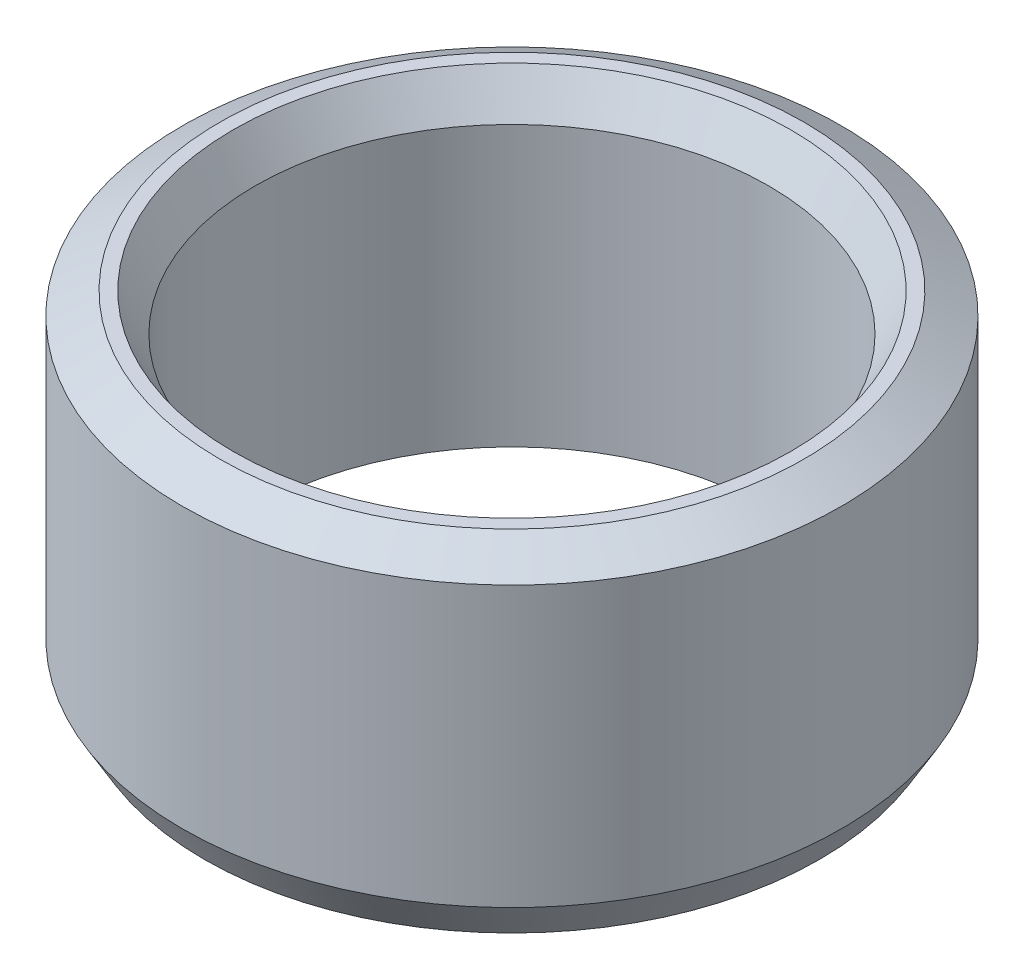
from build123d import *
from OCP.BRepFilletAPI import BRepFilletAPI_MakeChamfer

# Parameters (mm, degrees)
SKETCH1_R           = 55
BOSS_EXTRUDE1_DEPTH = 56.547134441
SKETCH2_R           = 42.849265266
CUT_EXTRUDE1_DEPTH  = 97.164330255
CHAMFER1_SIZE       = 3.666917211
CHAMFER1_SIZE2      = 6.270713722


with BuildPart() as part:
    # Sketch1 → Boss-Extrude1 (new body)
    with BuildSketch(Plane(origin=(0, 0, 0), x_dir=(1, 0, 0), z_dir=(0, 1, 0))):
        Circle(SKETCH1_R)
    extrude(amount=BOSS_EXTRUDE1_DEPTH)

    # Sketch2 → Cut-Extrude1 (cut, through all)
    with BuildSketch(Plane(origin=(0, 0, 0), x_dir=(1, 0, 0), z_dir=(0, 1, 0))):
        Circle(SKETCH2_R)
    extrude(amount=CUT_EXTRUDE1_DEPTH, mode=Mode.SUBTRACT)

    # Chamfer1: one chamfer whose edges measure the first distance from different faces: ONE call of the kernel's chamfer builder (chamfer() names one face for all edges)
    chamfer1_edges_1 = [part.edges().sort_by_distance(p)[0] for p in [
        (-42.849265266, 56.547134441, 0),
    ]]
    chamfer1_side_1 = [part.faces().sort_by_distance(p)[0] for p in [
        (-53.444365081, 56.547134441, 0),
    ]]
    chamfer1_edges_2 = [part.edges().sort_by_distance(p)[0] for p in [
        (-42.849265266, 0, 0),
    ]]
    chamfer1_side_2 = [part.faces().sort_by_distance(p)[0] for p in [
        (-42.849265266, 28.27356722, 0),
    ]]
    chamfer1_edges_3 = [part.edges().sort_by_distance(p)[0] for p in [
        (-55, 0, 0),
    ]]
    chamfer1_side_3 = [part.faces().sort_by_distance(p)[0] for p in [
        (-53.444365081, 0, 0),
    ]]
    chamfer1_edges_4 = [part.edges().sort_by_distance(p)[0] for p in [
        (-55, 56.547134441, 0),
    ]]
    chamfer1_side_4 = [part.faces().sort_by_distance(p)[0] for p in [
        (-55, 28.27356722, 0),
    ]]
    chamfer1 = BRepFilletAPI_MakeChamfer(part.part.solid().wrapped)
    for e in chamfer1_edges_1:
        chamfer1.Add(CHAMFER1_SIZE, CHAMFER1_SIZE2, e.wrapped, chamfer1_side_1[0].wrapped)  # the first distance lies on this face
    for e in chamfer1_edges_2:
        chamfer1.Add(CHAMFER1_SIZE, CHAMFER1_SIZE2, e.wrapped, chamfer1_side_2[0].wrapped)  # the first distance lies on this face
    for e in chamfer1_edges_3:
        chamfer1.Add(CHAMFER1_SIZE, CHAMFER1_SIZE2, e.wrapped, chamfer1_side_3[0].wrapped)  # the first distance lies on this face
    for e in chamfer1_edges_4:
        chamfer1.Add(CHAMFER1_SIZE, CHAMFER1_SIZE2, e.wrapped, chamfer1_side_4[0].wrapped)  # the first distance lies on this face
    add(Compound.cast(chamfer1.Shape()), mode=Mode.REPLACE)


solid = part.part
